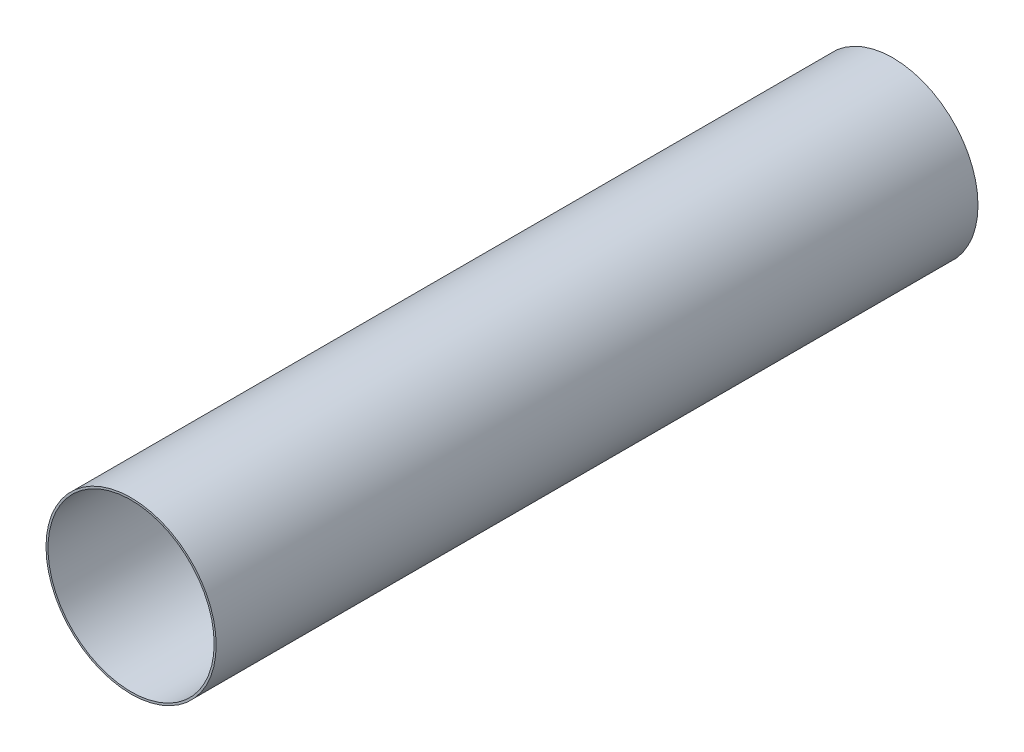
from build123d import *

# Parameters (mm, degrees)
SKETCH1_R           = 85.09991
SKETCH1_R_2         = 83.09991
BOSS_EXTRUDE1_DEPTH = 381


with BuildPart() as part:
    # Sketch1 → Boss-Extrude1 (new, symmetric)
    with BuildSketch(Plane.XY):
        Circle(SKETCH1_R)
        Circle(SKETCH1_R_2, mode=Mode.SUBTRACT)
    extrude(amount=BOSS_EXTRUDE1_DEPTH, both=True)


solid = part.part
